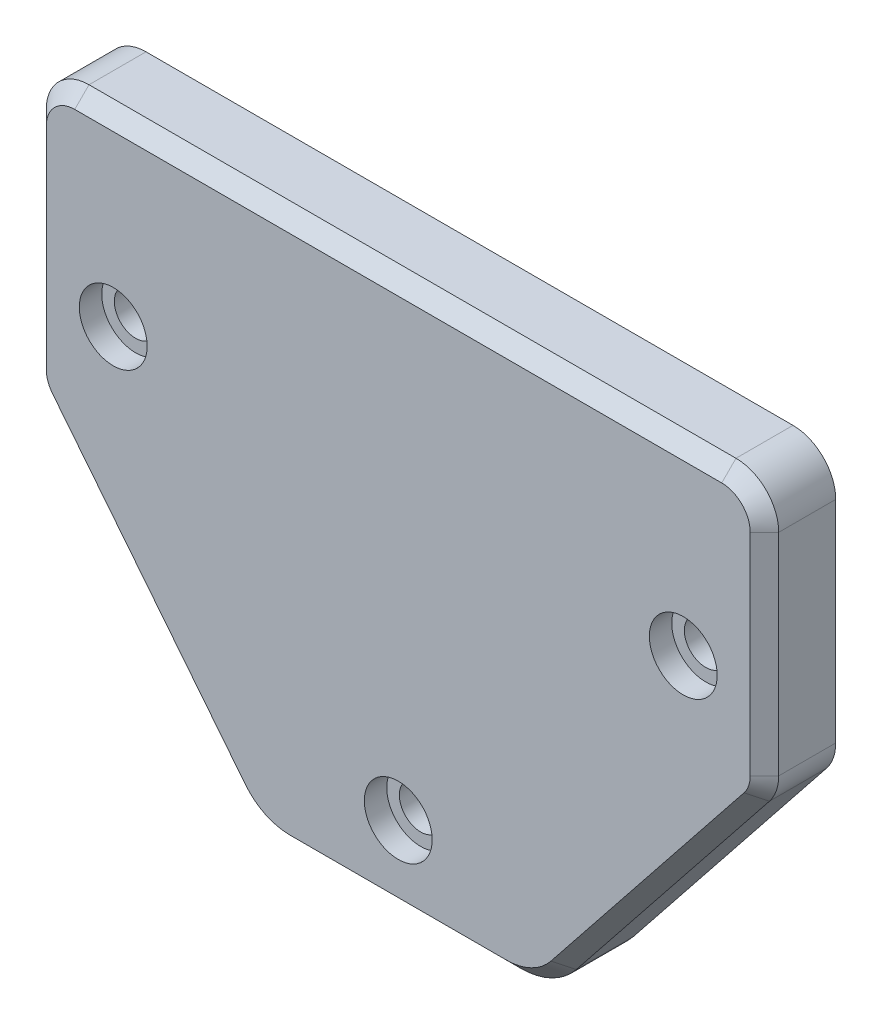
from build123d import *

# Parameters (mm, degrees)
CROQUIS1_R                   = 1.5
SALIENTE_EXTRUIR1_DEPTH      = 5
CHAFL_N1_SIZE                = 1
TALADROAVANZADO1_START       = 3.4252
TALADROAVANZADO1_OUTLINE_R   = 2.38125
TALADROAVANZADO1_OUTLINE_R_2 = 1.5
TALADROAVANZADO1_DEPTH       = 1.5748


# Read off the part's stored shape, not the designer's step: TaladroAvanzado1
with BuildPart() as part:
    # Croquis1 → Saliente-Extruir1 (new body)
    with BuildSketch(Plane.XY):
        with BuildLine():
            Line((-7.5911494, -25.7), (7.5911494, -25.7))
            ThreePointArc((7.5911494, -25.7), (9.761282919, -25.204500029), (11.501296, -23.816208204))
            Line((11.501296, -23.816208204), (25.04608796, -6.820513834))
            ThreePointArc((25.04608796, -6.820513834), (25.531807186, -5.941176745), (25.7, -4.950788912))
            Line((25.7, -4.950788912), (25.7, 9.85))
            ThreePointArc((25.7, 9.85), (24.821320344, 11.971320344), (22.7, 12.85))
            Line((22.7, 12.85), (0, 12.85))
            Line((0, 12.85), (-22.7, 12.85))
            ThreePointArc((-22.7, 12.85), (-24.821320344, 11.971320344), (-25.7, 9.85))
            Line((-25.7, 9.85), (-25.7, -4.950788912))
            ThreePointArc((-25.7, -4.950788912), (-25.531807186, -5.941176745), (-25.04608796, -6.820513834))
            Line((-25.04608796, -6.820513834), (-11.501296, -23.816208204))
            ThreePointArc((-11.501296, -23.816208204), (-9.761282919, -25.204500029), (-7.5911494, -25.7))
        make_face()
        with Locations((-20, 0)):
            Circle(CROQUIS1_R, mode=Mode.SUBTRACT)
        with Locations(Location((20, 0, 0), (0, 0, 180))):
            Circle(CROQUIS1_R, mode=Mode.SUBTRACT)
        with Locations((0, -20)):
            Circle(CROQUIS1_R, mode=Mode.SUBTRACT)
    extrude(amount=SALIENTE_EXTRUIR1_DEPTH)

    # Chaflán1
    chafl_n1_edges = [part.edges().sort_by_distance(p)[0] for p in [
        (-25.7, 2.449605544, 5),
        (-25.531807186, -5.941176745, 5),
        (-18.27369198, -15.318361019, 5),
        (-9.761282919, -25.204500029, 5),
        (0, -25.7, 5),
        (9.761282919, -25.204500029, 5),
        (18.27369198, -15.318361019, 5),
        (25.531807186, -5.941176745, 5),
        (25.7, 2.449605544, 5),
        (24.821320344, 11.971320344, 5),
        (0, 12.85, 5),
        (-24.821320344, 11.971320344, 5),
    ]]
    chamfer(chafl_n1_edges, length=CHAFL_N1_SIZE)

    # TaladroAvanzado1 outline → TaladroAvanzado1 (cut)
    # profile 1 of 3: a face of its own
    with BuildSketch(Plane.XY.offset(TALADROAVANZADO1_START)):
        with Locations((0, -20)):
            Circle(TALADROAVANZADO1_OUTLINE_R)
        with Locations((0, -20)):
            Circle(TALADROAVANZADO1_OUTLINE_R_2, mode=Mode.SUBTRACT)
    # profile 2 of 3: a face of its own
    with BuildSketch(Plane.XY.offset(TALADROAVANZADO1_START)):
        with Locations((20, 0)):
            Circle(TALADROAVANZADO1_OUTLINE_R)
        with Locations((20, 0)):
            Circle(TALADROAVANZADO1_OUTLINE_R_2, mode=Mode.SUBTRACT)
    # profile 3 of 3: a face of its own
    with BuildSketch(Plane.XY.offset(TALADROAVANZADO1_START)):
        with Locations((-20, 0)):
            Circle(TALADROAVANZADO1_OUTLINE_R)
        with Locations((-20, 0)):
            Circle(TALADROAVANZADO1_OUTLINE_R_2, mode=Mode.SUBTRACT)
    extrude(amount=TALADROAVANZADO1_DEPTH, mode=Mode.SUBTRACT)


solid = part.part
